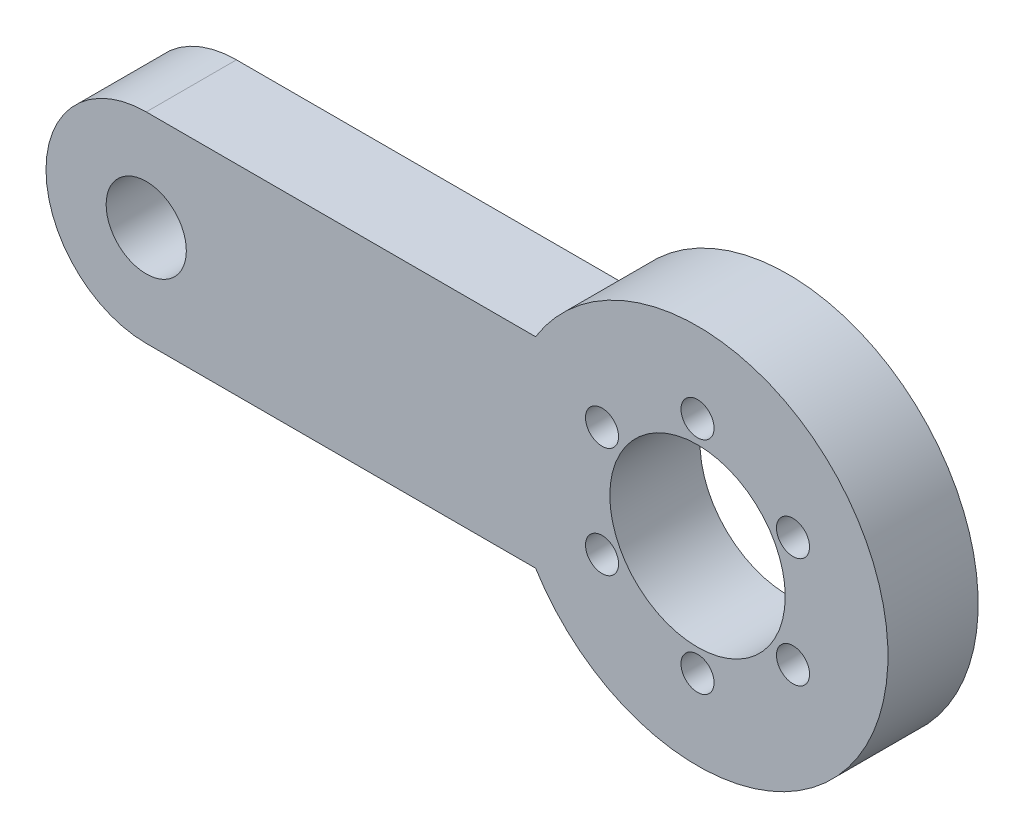
from build123d import *
from build123d.topology import SkipClean

# Parameters (mm, degrees)
ESQUISSE1_W                  = 50
ESQUISSE1_H                  = 20
BOSS_EXTRU_1_DEPTH           = 9
ESQUISSE2_W                  = 30
ESQUISSE2_H                  = 30
BOSS_EXTRU_2_DEPTH           = 9
ENL_V_MAT_EXTRU_1_DEPTH      = 85.297093663
ENL_V_MAT_EXTRU_1_DEPTH_BACK = 85.297093663
ESQUISSE3_R                  = 8.75
ESQUISSE3_R_2                = 1.65
ENL_V_MAT_EXTRU_2_DEPTH      = 85.297093663
ENL_V_MAT_EXTRU_2_DEPTH_BACK = 85.297093663
ESQUISSE4_R                  = 4
CONG_1_R                     = 10
ESQUISSE6_R                  = 19
ESQUISSE6_R_2                = 14
BOSS_EXTRU_3_DEPTH           = 9
ENL_V_MAT_EXTRU_4_DEPTH      = 90.319650693


with BuildPart() as part:
    # Esquisse1 → Boss.-Extru.1 (new body)
    with BuildSketch(Plane.XY):
        with Locations((25, 10)):
            Rectangle(ESQUISSE1_W, ESQUISSE1_H)
    extrude(amount=BOSS_EXTRU_1_DEPTH)

    # Esquisse2 → Boss.-Extru.2 (add)
    with BuildSketch(Plane.XY.offset(9)):
        with Locations((65, 10)):
            Rectangle(ESQUISSE2_W, ESQUISSE2_H)
    extrude(amount=-BOSS_EXTRU_2_DEPTH)

    # Esquisse3 → Enlèv. mat.-Extru.1 (cut, two sides: drawn at the far end of the back side and taken through both)
    with BuildSketch(Plane.XY.offset(9).offset(-ENL_V_MAT_EXTRU_1_DEPTH_BACK)):
        with Locations((65, 10)):
            Circle(ESQUISSE3_R)
        with Locations((65, -1)):
            Circle(ESQUISSE3_R_2)
        with Locations((55.473720558, 4.5)):
            Circle(ESQUISSE3_R_2)
        with Locations((55.473720558, 15.5)):
            Circle(ESQUISSE3_R_2)
        with Locations((65, 21)):
            Circle(ESQUISSE3_R_2)
        with Locations((74.526279442, 15.5)):
            Circle(ESQUISSE3_R_2)
        with Locations((74.526279442, 4.5)):
            Circle(ESQUISSE3_R_2)
    extrude(amount=ENL_V_MAT_EXTRU_1_DEPTH + ENL_V_MAT_EXTRU_1_DEPTH_BACK, mode=Mode.SUBTRACT)

    # Esquisse4 → Enlèv. mat.-Extru.2 (cut, two sides: drawn at the far end of the back side and taken through both)
    with BuildSketch(Plane.XY.offset(9).offset(-ENL_V_MAT_EXTRU_2_DEPTH_BACK)):
        with Locations((10, 10)):
            Circle(ESQUISSE4_R)
    extrude(amount=ENL_V_MAT_EXTRU_2_DEPTH + ENL_V_MAT_EXTRU_2_DEPTH_BACK, mode=Mode.SUBTRACT)

    # Congé1
    cong_1_edges = [part.edges().sort_by_distance(p)[0] for p in [
        (0, 0, 4.5),
        (0, 20, 4.5),
    ]]
    fillet(cong_1_edges, radius=CONG_1_R - 0.0001)  # a hair under: the kernel refuses the full size

    # Esquisse6 → Boss.-Extru.3 (add)
    with BuildSketch(Plane.XY.offset(9)):
        with Locations((65, 10)):
            Circle(ESQUISSE6_R)
        with Locations((65, 10)):
            Circle(ESQUISSE6_R_2, mode=Mode.SUBTRACT)
    extrude(amount=-BOSS_EXTRU_3_DEPTH)

    # Esquisse7 → Enlèv. mat.-Extru.4 (cut, through all)
    with SkipClean():  # the faces are left unmerged after this step: merging them gives an invalid solid
        with BuildSketch(Plane.XY.offset(9)):
            with BuildLine():
                Line((48.844505579, 0), (48.844505579, -10.5))
                Line((48.844505579, -10.5), (84.844505579, -10.5))
                Line((84.844505579, -10.5), (84.844505579, 30.5))
                Line((84.844505579, 30.5), (48.844505579, 30.5))
                Line((48.844505579, 30.5), (48.844505579, 20))
                ThreePointArc((48.844505579, 20), (84, 10), (48.844505579, 0))
            make_face()
        extrude(amount=-ENL_V_MAT_EXTRU_4_DEPTH, mode=Mode.SUBTRACT)


solid = part.part
